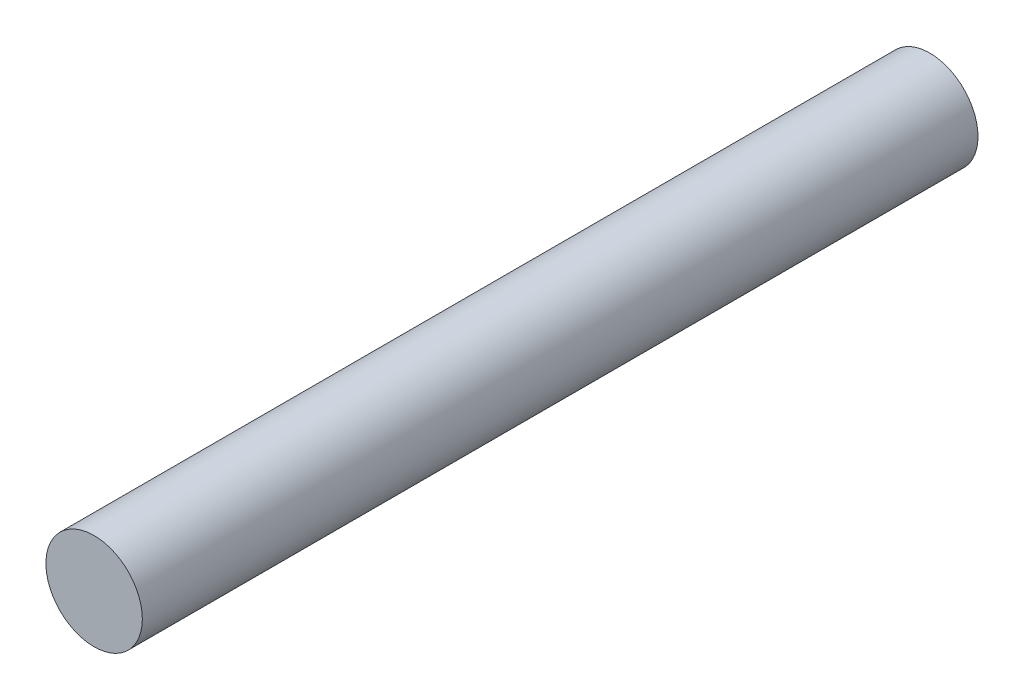
from build123d import *

# Parameters (mm, degrees)
SKETCH1_R           = 75
BOSS_EXTRUDE1_DEPTH = 1300
SKETCH2_R           = 32.789084348
CUT_EXTRUDE1_DEPTH  = 209


with BuildPart() as part:
    # Sketch1 → Boss-Extrude1 (new body)
    with BuildSketch(Plane.XY):
        Circle(SKETCH1_R)
    extrude(amount=BOSS_EXTRUDE1_DEPTH)

    # Sketch2 → Cut-Extrude1 (cut)
    with BuildSketch(Plane(origin=(0, 0, 0), x_dir=(-1, 0, 0), z_dir=(0, 0, -1))):
        Circle(SKETCH2_R)
    extrude(amount=-CUT_EXTRUDE1_DEPTH, mode=Mode.SUBTRACT)


solid = part.part
